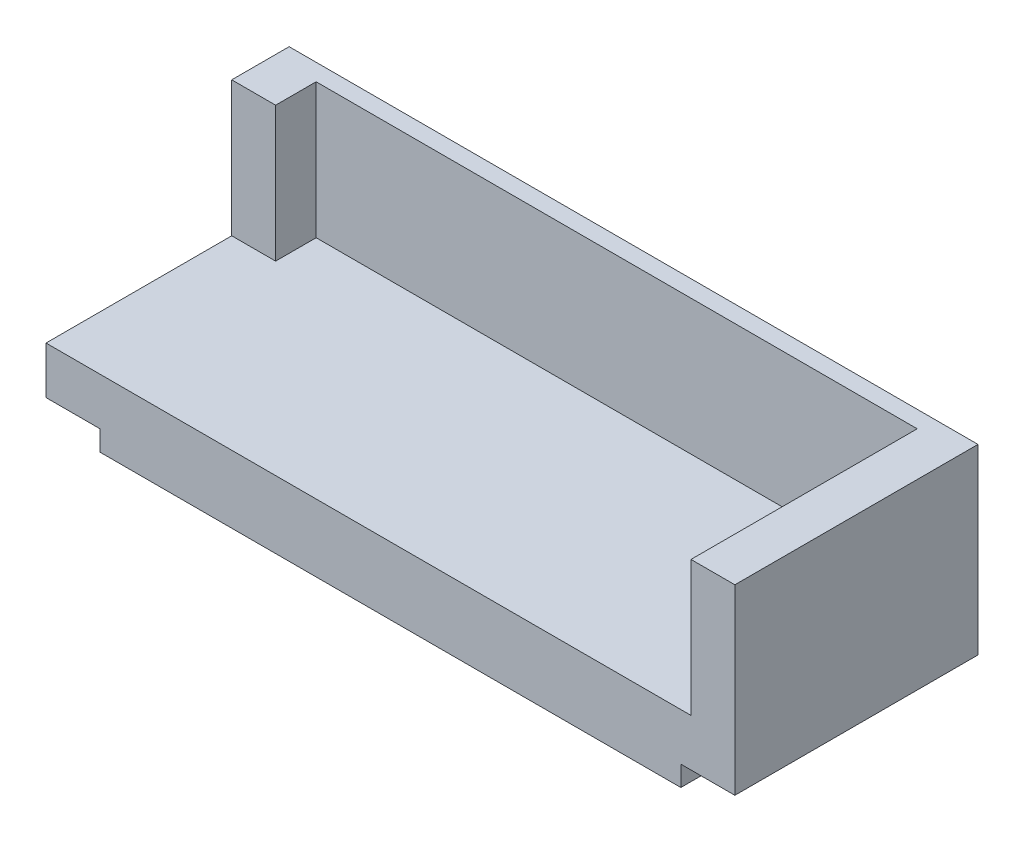
from build123d import *

# Parameters (mm, degrees)
BOSS_EXTRU_1_DEPTH      = 3.5
BOSS_EXTRU_1_DEPTH_BACK = 1.5
ESQUISSE2_W             = 43
ESQUISSE2_H             = 18
ESQUISSE3_W             = 18
ESQUISSE3_H             = 3.5
BOSS_EXTRU_2_DEPTH      = 4
ESQUISSE4_W             = 18
ESQUISSE4_H             = 3.5
BOSS_EXTRU_3_DEPTH      = 4
ESQUISSE5_W             = 51
ESQUISSE5_H             = 1.25
BOSS_EXTRU_4_DEPTH      = 10
ESQUISSE6_W             = 3.25
ESQUISSE6_H             = 16.75
BOSS_EXTRU_5_DEPTH      = 10
ESQUISSE7_W             = 3.25
ESQUISSE7_H             = 3
BOSS_EXTRU_6_DEPTH      = 10


with BuildPart() as part:
    # Esquisse2 → Boss.-Extru.1 (new, two sides: drawn at the far end of the back side and taken through both)
    with BuildSketch(Plane(origin=(0, 0, 0), x_dir=(1, 0, 0), z_dir=(0, 1, 0)).offset(-BOSS_EXTRU_1_DEPTH_BACK)):
        with Locations((21.5, 9)):
            Rectangle(ESQUISSE2_W, ESQUISSE2_H)
    extrude(amount=BOSS_EXTRU_1_DEPTH + BOSS_EXTRU_1_DEPTH_BACK)

    # Esquisse3 → Boss.-Extru.2 (add)
    with BuildSketch(Plane(origin=(43, 0, 0), x_dir=(0, 0, -1), z_dir=(1, 0, 0))):
        with Locations((9, 1.75)):
            Rectangle(ESQUISSE3_W, ESQUISSE3_H)
    extrude(amount=BOSS_EXTRU_2_DEPTH)

    # Esquisse4 → Boss.-Extru.3 (add)
    with BuildSketch(Plane.ZY):
        with Locations((-9, 1.75)):
            Rectangle(ESQUISSE4_W, ESQUISSE4_H)
    extrude(amount=BOSS_EXTRU_3_DEPTH)

    # Esquisse5 → Boss.-Extru.4 (add)
    with BuildSketch(Plane(origin=(0, 3.5, 0), x_dir=(1, 0, 0), z_dir=(0, 1, 0))):
        with Locations((21.5, 17.375)):
            Rectangle(ESQUISSE5_W, ESQUISSE5_H)
    extrude(amount=BOSS_EXTRU_4_DEPTH)

    # Esquisse6 → Boss.-Extru.5 (add)
    with BuildSketch(Plane(origin=(0, 3.5, 0), x_dir=(1, 0, 0), z_dir=(0, 1, 0))):
        with Locations((45.375, 8.375)):
            Rectangle(ESQUISSE6_W, ESQUISSE6_H)
    extrude(amount=BOSS_EXTRU_5_DEPTH)

    # Esquisse7 → Boss.-Extru.6 (add)
    with BuildSketch(Plane(origin=(0, 3.5, 0), x_dir=(1, 0, 0), z_dir=(0, 1, 0))):
        with Locations((-2.375, 15.25)):
            Rectangle(ESQUISSE7_W, ESQUISSE7_H)
    extrude(amount=BOSS_EXTRU_6_DEPTH)


solid = part.part
